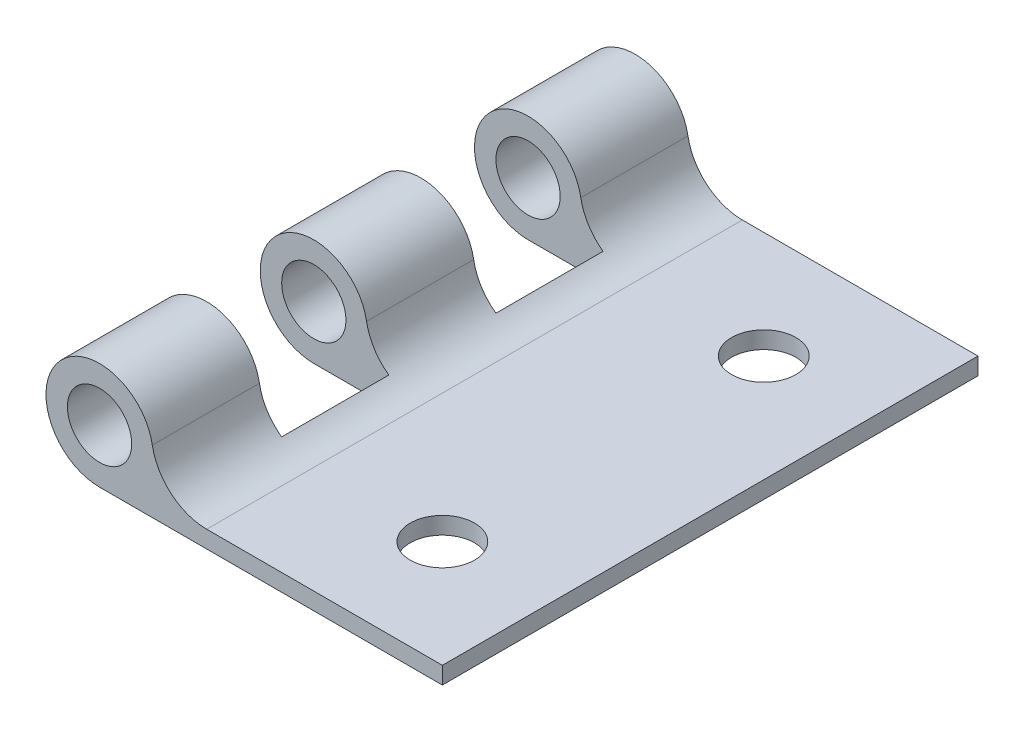
from build123d import *

# Parameters (mm, degrees)
ESBO_O1_R                = 1.5
RESSALTO_EXTRUS_O1_DEPTH = 25
ESBO_O2_R                = 1.5
ESBO_O2_W                = 6
ESBO_O2_H                = 5
CORTE_EXTRUS_O1_DEPTH    = 32.5


with BuildPart() as part:
    # Esboço1 → Ressalto-extrusão1 (new body)
    with BuildSketch(Plane.XY):
        with BuildLine():
            Line((0, 0), (-16, 0))
            ThreePointArc((-16, 0), (-18.499911314, 2.521057642), (-15.95788621, 4.999645261))
            ThreePointArc((-15.95788621, 4.999645261), (-14.375952887, 4.400650146), (-13.537523452, 2.9315197))
            ThreePointArc((-13.537523452, 2.9315197), (-12.656985327, 1.403588896), (-11, 0.8))
            Line((-11, 0.8), (0, 0.8))
            Line((0, 0.8), (0, 0))
        make_face()
        with Locations((-16, 2.5)):
            Circle(ESBO_O1_R, mode=Mode.SUBTRACT)
    extrude(amount=RESSALTO_EXTRUS_O1_DEPTH)

    # Esboço2 → Corte-extrusão1 (cut, through all)
    with BuildSketch(Plane.XZ):
        with Locations((-5, 20)):
            Circle(ESBO_O2_R)
        with Locations((-5, 5)):
            Circle(ESBO_O2_R)
        with Locations((-15.5, 7.5)):
            Rectangle(ESBO_O2_W, ESBO_O2_H)
        with Locations((-15.5, 17.5)):
            Rectangle(ESBO_O2_W, ESBO_O2_H)
        with Locations((-15.5, 27.5)):
            Rectangle(ESBO_O2_W, ESBO_O2_H)
    extrude(amount=-CORTE_EXTRUS_O1_DEPTH, mode=Mode.SUBTRACT)


solid = part.part
